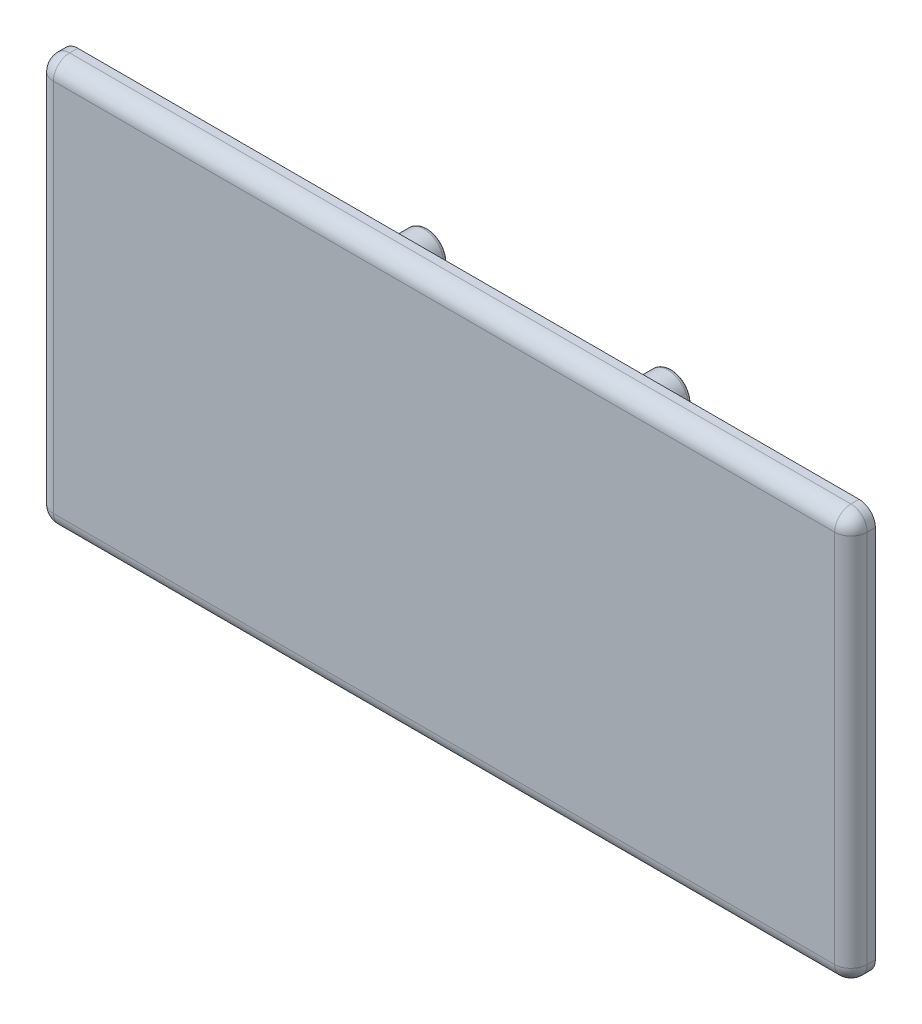
from build123d import *

# Parameters (mm, degrees)
BOSS_EXTRUDE1_DEPTH = 3
FILLET1_R           = 2
SKETCH2_W           = 10
SKETCH2_H           = 3
SKETCH2_W_2         = 3
SKETCH2_H_2         = 20
BOSS_EXTRUDE2_DEPTH = 1.5
FILLET2_R           = 1
SKETCH3_R           = 2.5099
BOSS_EXTRUDE3_DEPTH = 10
FILLET3_R           = 0.5


with BuildPart() as part:
    # Sketch1 → Boss-Extrude1 (new body)
    with BuildSketch(Plane.XY):
        with BuildLine():
            Line((-48, -25), (48, -25))
            ThreePointArc((48, -25), (49.414213562, -24.414213562), (50, -23))
            Line((50, -23), (50, 23))
            ThreePointArc((50, 23), (49.414213562, 24.414213562), (48, 25))
            Line((48, 25), (-48, 25))
            ThreePointArc((-48, 25), (-49.414213562, 24.414213562), (-50, 23))
            Line((-50, 23), (-50, -23))
            ThreePointArc((-50, -23), (-49.414213562, -24.414213562), (-48, -25))
        make_face()
    extrude(amount=BOSS_EXTRUDE1_DEPTH)

    # Fillet1
    fillet1_edges = [part.edges().sort_by_distance(p)[0] for p in [
        (-50, 0, 3),
        (-49.414213562, 24.414213562, 3),
        (0, 25, 3),
        (49.414213562, 24.414213562, 3),
        (50, 0, 3),
        (49.414213562, -24.414213562, 3),
        (0, -25, 3),
        (-49.414213562, -24.414213562, 3),
    ]]
    fillet(fillet1_edges, radius=FILLET1_R)

    # Sketch2 → Boss-Extrude2 (add)
    with BuildSketch(Plane(origin=(0, 0, 0), x_dir=(-1, 0, 0), z_dir=(0, 0, -1))):
        with Locations((-30, -20)):
            Rectangle(SKETCH2_W, SKETCH2_H)
        with Locations((30, -20)):
            Rectangle(SKETCH2_W, SKETCH2_H)
        with Locations((-45, 0)):
            Rectangle(SKETCH2_W_2, SKETCH2_H_2)
        with Locations((45, 0)):
            Rectangle(SKETCH2_W_2, SKETCH2_H_2)
        with Locations((-30, 20)):
            Rectangle(SKETCH2_W, SKETCH2_H)
        with Locations((30, 20)):
            Rectangle(SKETCH2_W, SKETCH2_H)
    extrude(amount=BOSS_EXTRUDE2_DEPTH)

    # Fillet2
    fillet2_edges = [part.edges().sort_by_distance(p)[0] for p in [
        (-25, 20, -1.5),
        (-30, 21.5, -1.5),
        (-35, 20, -1.5),
        (-30, 18.5, -1.5),
        (-35, -20, -1.5),
        (-30, -21.5, -1.5),
        (-25, -20, -1.5),
        (-30, -18.5, -1.5),
        (-45, 10, -1.5),
        (-46.5, 0, -1.5),
        (-45, -10, -1.5),
        (-43.5, 0, -1.5),
        (25, -20, -1.5),
        (30, -21.5, -1.5),
        (35, -20, -1.5),
        (30, -18.5, -1.5),
        (46.5, 0, -1.5),
        (45, 10, -1.5),
        (43.5, 0, -1.5),
        (45, -10, -1.5),
        (30, 21.5, -1.5),
        (25, 20, -1.5),
        (30, 18.5, -1.5),
        (35, 20, -1.5),
        (-25, 21.5, -0.75),
        (-35, 21.5, -0.75),
        (-35, 18.5, -0.75),
        (-25, 18.5, -0.75),
        (-25, -18.5, -0.75),
        (-25, -21.5, -0.75),
        (-35, -21.5, -0.75),
        (-35, -18.5, -0.75),
        (-46.5, -10, -0.75),
        (-43.5, -10, -0.75),
        (-46.5, 10, -0.75),
        (-43.5, 10, -0.75),
        (25, -18.5, -0.75),
        (25, -21.5, -0.75),
        (35, -18.5, -0.75),
        (35, -21.5, -0.75),
        (25, 21.5, -0.75),
        (25, 18.5, -0.75),
        (35, 21.5, -0.75),
        (35, 18.5, -0.75),
        (43.5, 10, -0.75),
        (46.5, 10, -0.75),
        (46.5, -10, -0.75),
        (43.5, -10, -0.75),
    ]]
    fillet(fillet2_edges, radius=FILLET2_R)

    # Sketch3 → Boss-Extrude3 (add)
    with BuildSketch(Plane(origin=(0, 0, 0), x_dir=(-1, 0, 0), z_dir=(0, 0, -1))):
        with Locations((-14.99997, 14.99997)):
            Circle(SKETCH3_R)
        with Locations((-14.99997, -14.99997)):
            Circle(SKETCH3_R)
        with Locations((14.99997, -14.99997)):
            Circle(SKETCH3_R)
        with Locations((14.99997, 14.99997)):
            Circle(SKETCH3_R)
    extrude(amount=BOSS_EXTRUDE3_DEPTH)

    # Fillet3
    fillet3_edges = [part.edges().sort_by_distance(p)[0] for p in [
        (17.50987, 14.99997, -10),
        (-12.49007, -14.99997, -10),
        (-12.49007, 14.99997, -10),
        (17.50987, -14.99997, -10),
    ]]
    fillet(fillet3_edges, radius=FILLET3_R)


solid = part.part
